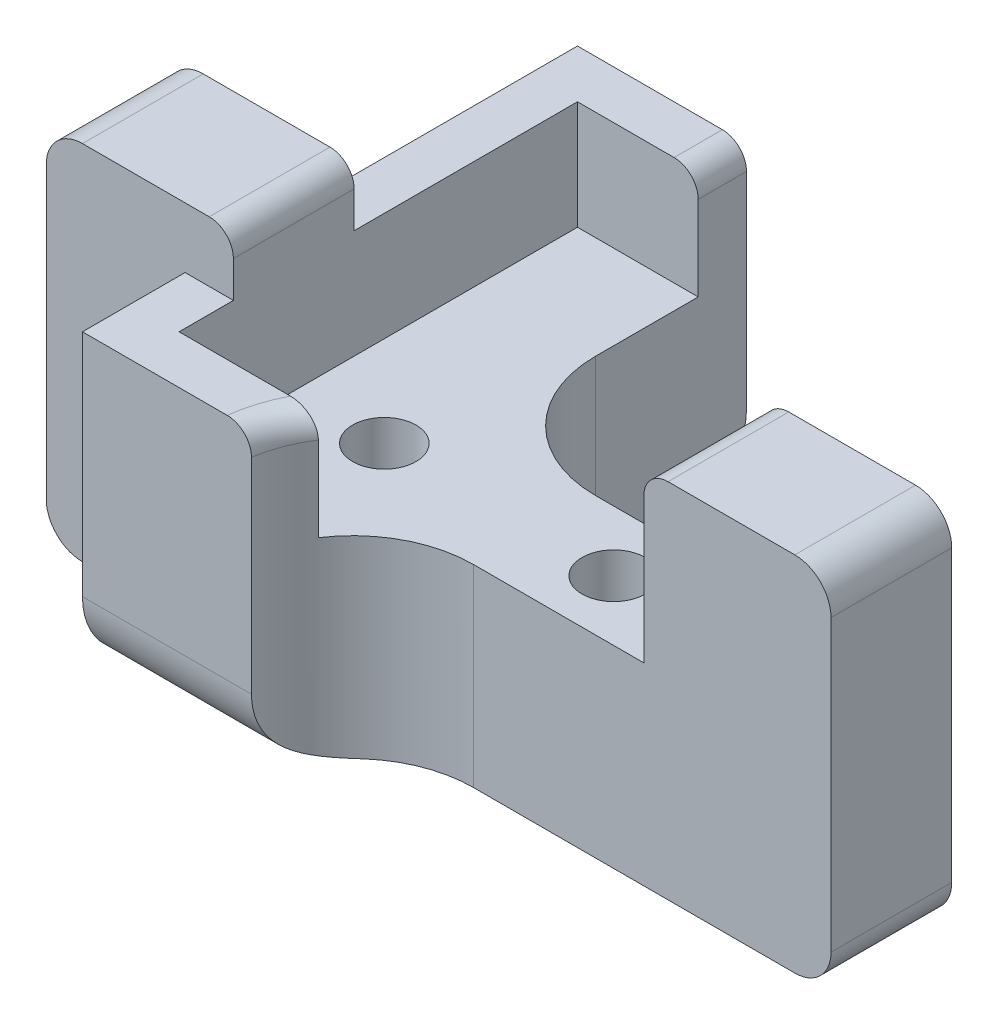
from build123d import *

# Parameters (mm, degrees)
SKETCH1_W           = 65
SKETCH1_H           = 30
BOSS_EXTRUDE1_DEPTH = 10
SKETCH2_W           = 34
SKETCH2_H           = 10
CUT_EXTRUDE1_DEPTH  = 14
SKETCH4_R           = 2.625
CUT_EXTRUDE3_DEPTH  = 45
FILLET1_R           = 3
SKETCH5_W           = 10
SKETCH5_H           = 4.5
SKETCH5_H_2         = 18.5
BOSS_EXTRUDE2_DEPTH = 16
CUT_EXTRUDE2_DEPTH  = 10
SKETCH6_W           = 10
SKETCH6_H           = 25
BOSS_EXTRUDE3_DEPTH = 4
BOSS_EXTRUDE4_START = -33
SKETCH6_2_W         = 10
SKETCH6_2_H         = 25
BOSS_EXTRUDE4_DEPTH = 4
BOSS_EXTRUDE7_REACH = 84.498
SKETCH7_W           = 4
SKETCH7_H           = 25
FILLET2_R           = 6
FILLET4_START       = 2.3595
FILLET4_DEPTH       = 13.6405
FILLET4_2_DEPTH     = 2.8314
FILLET4_START_2     = 6.0000001
FILLET4_3_DEPTH     = 18.9999999
FILLET4_START_3     = 25.5
FILLET4_4_DEPTH     = 9.886859967
FILLET4_5_DEPTH     = 6.00000009
FILLET7_R           = 2
BOSS_EXTRUDE8_DEPTH = 4.75


with BuildPart() as part:
    # Sketch1 → Boss-Extrude1 (new body)
    with BuildSketch(Plane.XY):
        with Locations((32.5, 15)):
            Rectangle(SKETCH1_W, SKETCH1_H)
    extrude(amount=BOSS_EXTRUDE1_DEPTH)

    # Sketch2 → Cut-Extrude1 (cut)
    with BuildSketch(Plane(origin=(0, 30, 0), x_dir=(1, 0, 0), z_dir=(0, 1, 0))):
        with Locations((32.5, -5)):
            Rectangle(SKETCH2_W, SKETCH2_H)
    extrude(amount=-CUT_EXTRUDE1_DEPTH, mode=Mode.SUBTRACT)

    # Sketch4 → Cut-Extrude3 (cut)
    with BuildSketch(Plane(origin=(0, 16, 0), x_dir=(1, 0, 0), z_dir=(0, 1, 0))):
        with Locations(Location((23, -5, 0), (0, 0, 270))):
            Circle(SKETCH4_R)
        with Locations(Location((42, -5, 0), (0, 0, 270))):
            Circle(SKETCH4_R)
    extrude(amount=-CUT_EXTRUDE3_DEPTH, mode=Mode.SUBTRACT)

    # Fillet1
    fillet1_edges = [part.edges().sort_by_distance(p)[0] for p in [
        (0, 30, 5),
        (0, 0, 5),
        (65, 0, 5),
        (65, 30, 5),
    ]]
    fillet(fillet1_edges, radius=FILLET1_R)

    # Sketch5 → Boss-Extrude2 (add)
    with BuildSketch(Plane(origin=(0, 16, 0), x_dir=(1, 0, 0), z_dir=(0, 1, 0))):
        with Locations((20.5, -12.25)):
            Rectangle(SKETCH5_W, SKETCH5_H)
        with BuildLine():
            Line((25.5, 0), (15.5, 0))
            Line((15.5, 0), (15.5, -10))
            Line((15.5, -10), (25.5, -10))
            Line((25.5, -10), (25.5, -5.80039053))
            ThreePointArc((25.5, -5.80039053), (20.375, -5), (25.5, -4.19960947))
            Line((25.5, -4.19960947), (25.5, 0))
        make_face()
        with Locations((20.5, 9.25)):
            Rectangle(SKETCH5_W, SKETCH5_H_2)
    extrude(amount=-BOSS_EXTRUDE2_DEPTH)

    # Sketch3 → Cut-Extrude2 (cut)
    with BuildSketch(Plane.XZ):
        Polygon((20.61843014, 9.125), (18.236860279, 5), (20.61843014, 0.875), (25.38156986, 0.875), (27.763139721, 5), (25.38156986, 9.125), align=None)
        Polygon((46.763139721, 5), (44.38156986, 9.125), (39.61843014, 9.125), (37.236860279, 5), (39.61843014, 0.875), (44.38156986, 0.875), align=None)
    extrude(amount=-CUT_EXTRUDE2_DEPTH, mode=Mode.SUBTRACT)

    # Sketch6 → Boss-Extrude3 (add)
    with BuildSketch(Plane.XY.offset(14.5)):
        with Locations((20.5, 12.5)):
            Rectangle(SKETCH6_W, SKETCH6_H)
    extrude(amount=BOSS_EXTRUDE3_DEPTH)

    # Sketch6<2> → Boss-Extrude4 (add)
    with BuildSketch(Plane.XY.offset(14.5).offset(BOSS_EXTRUDE4_START)):
        with Locations((20.5, 12.5)):
            Rectangle(SKETCH6_2_W, SKETCH6_2_H)
    extrude(amount=-BOSS_EXTRUDE4_DEPTH)

    # Boss-Extrude7: up to this face of the body (flat: up to its plane)
    boss_extrude7_end = Plane(part.part.faces().sort_by_distance((20.5, 12.5, -22.5))[0])
    # Sketch7 → Boss-Extrude7 (add, up to the picked face)
    with BuildSketch(Plane.XY.offset(18.5), mode=Mode.PRIVATE) as boss_extrude7_sk1:
        with Locations((13.5, 12.5)):
            Rectangle(SKETCH7_W, SKETCH7_H)
    boss_extrude7_tool1 = split(extrude(boss_extrude7_sk1.sketch, amount=-BOSS_EXTRUDE7_REACH, mode=Mode.PRIVATE), bisect_by=boss_extrude7_end, keep=Keep.BOTH, mode=Mode.PRIVATE)
    add(boss_extrude7_tool1.solids().sort_by(Axis((13.5, 12.5, 18.5), (0, 0, -1)))[0])

    # Fillet2
    fillet2_edges = [part.edges().sort_by_distance(p)[0] for p in [
        (18.5, 0, 18.5),
        (18.5, 0, -22.5),
    ]]
    fillet(fillet2_edges, radius=FILLET2_R)

    # Fillet4: read off the stored shape, not the designer's step
    # Fillet4 outline → Fillet4 (add)
    with BuildSketch(Plane(origin=(0, 0, 0), x_dir=(1, 0, 0), z_dir=(0, 1, 0)).offset(FILLET4_START)):
        with BuildLine():
            Line((25.5, -14.5), (27.035213422, -14.5))
            ThreePointArc((27.035213422, -14.5), (30.643443476, -11.196591569), (35.386859967, -10))
            Line((35.386859967, -10), (25.5, -10))
            Line((25.5, -10), (25.5, -14.5))
        make_face()
        with BuildLine():
            ThreePointArc((35.5, 0), (28.428932188, 2.928932188), (25.5, 10))
            Line((25.5, 10), (25.5, 0))
            Line((25.5, 0), (35.5, 0))
        make_face()
    extrude(amount=FILLET4_DEPTH)

    # Fillet4 2 outline → Fillet4 2 (add)
    with BuildSketch(Plane(origin=(0, 0, 0), x_dir=(1, 0, 0), z_dir=(0, 1, 0))):
        with BuildLine():
            ThreePointArc((35.5, 0), (28.428932188, 2.928932188), (25.5, 10))
            Line((25.5, 10), (25.5, 0))
            Line((25.5, 0), (35.5, 0))
        make_face()
    extrude(amount=FILLET4_2_DEPTH)

    # Fillet4 3 outline → Fillet4 3 (add)
    with BuildSketch(Plane(origin=(0, 0, 0), x_dir=(1, 0, 0), z_dir=(0, 1, 0)).offset(FILLET4_START_2)):
        with BuildLine():
            ThreePointArc((25.5, -18.5), (26.050866182, -16.416814258), (27.035213422, -14.5))
            Line((27.035213422, -14.5), (25.5, -14.5))
            Line((25.5, -14.5), (25.5, -18.5))
        make_face()
    extrude(amount=FILLET4_3_DEPTH)

    # Fillet4 4 outline → Fillet4 4 (add)
    with BuildSketch(Plane.YZ.offset(FILLET4_START_3)):
        with BuildLine():
            Line((0, 12.5), (0, 10))
            Line((0, 10), (2.3595, 10))
            Line((2.3595, 10), (2.3595, 14.5))
            Line((2.3595, 14.5), (6.0000001, 14.5))
            Line((6.0000001, 14.5), (6, 18.5))
            ThreePointArc((6, 18.5), (1.757359313, 16.742640687), (0, 12.5))
        make_face()
    extrude(amount=FILLET4_4_DEPTH)

    # Fillet4 5 outline → Fillet4 5 (cut)
    with BuildSketch(Plane(origin=(0, 0, 0), x_dir=(1, 0, 0), z_dir=(0, 1, 0))):
        with BuildLine():
            Line((25.5, -18.5), (25.272425218, -20))
            Line((25.272425218, -20), (35.386859967, -20))
            Line((35.386859967, -20), (35.386859967, -10))
            ThreePointArc((35.386859967, -10), (28.867657561, -12.417124556), (25.5, -18.5))
        make_face()
    extrude(amount=FILLET4_5_DEPTH, mode=Mode.SUBTRACT)

    # Fillet7
    fillet7_edges = [part.edges().sort_by_distance(p)[0] for p in [
        (25.5, 25, -20.5),
        (15.5, 30, 5),
        (49.5, 30, 5),
        (26.050866182, 25, 16.416814258),
    ]]
    fillet(fillet7_edges, radius=FILLET7_R)

    # Sketch3<2> → Boss-Extrude8 (add)
    with BuildSketch(Plane.XZ):
        Polygon((20.61843014, 9.125), (18.236860279, 5), (20.61843014, 0.875), (25.38156986, 0.875), (27.763139721, 5), (25.38156986, 9.125), align=None)
        Polygon((46.763139721, 5), (44.38156986, 9.125), (39.61843014, 9.125), (37.236860279, 5), (39.61843014, 0.875), (44.38156986, 0.875), align=None)
    extrude(amount=-BOSS_EXTRUDE8_DEPTH)


solid = part.part
